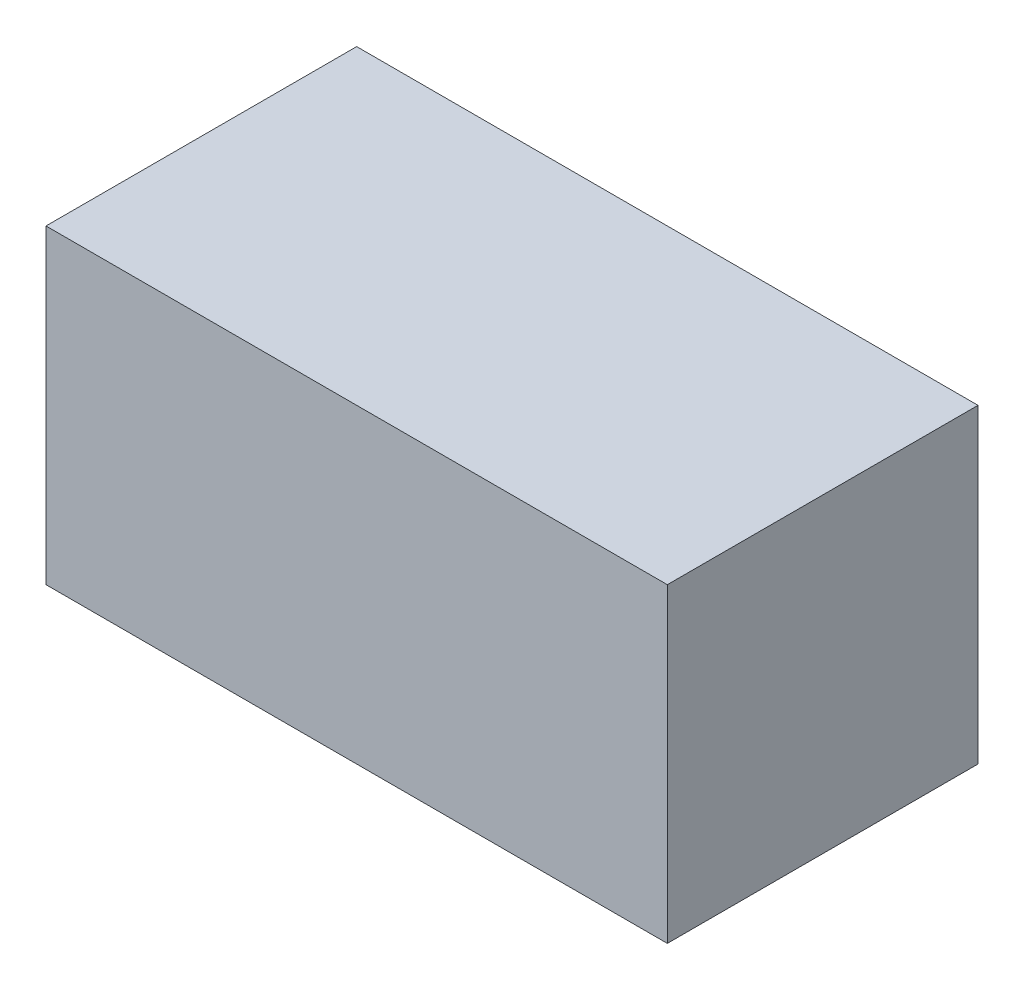
from build123d import *

# Parameters (mm, degrees)
SKETCH_1_W      = 100
SKETCH_1_H      = 50
EXTRUDE_1_DEPTH = 50


with BuildPart() as part:
    # 草图1 → 凸台-拉伸1 (new body)
    with BuildSketch(Plane.XY):
        with Locations((50, -25)):
            Rectangle(SKETCH_1_W, SKETCH_1_H)
    extrude(amount=-EXTRUDE_1_DEPTH)


solid = part.part
